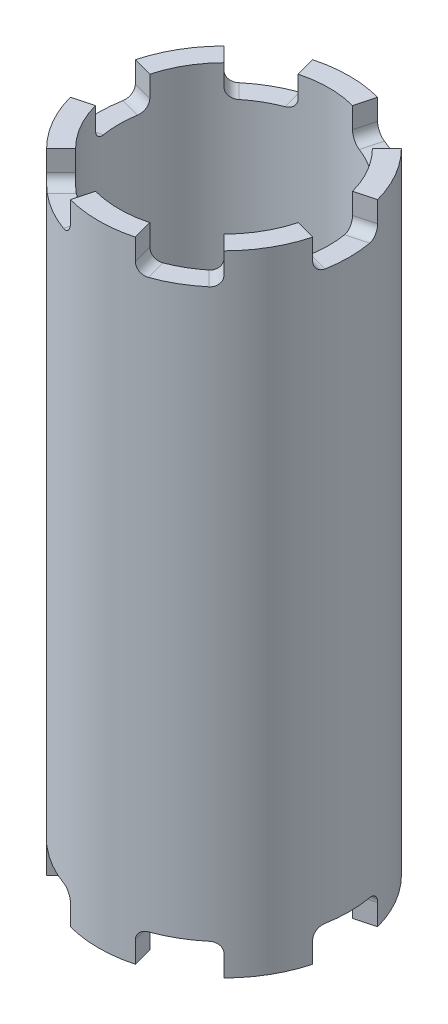
from build123d import *

# Parameters (mm, degrees)
SKETCH1_R            = 30.353
SKETCH1_R_2          = 25.4
BOSS_EXTRUDE1_DEPTH  = 152.4
CUT_EXTRUDE2_START   = -7.62
CUT_EXTRUDE2_DEPTH   = 7.62
FILLET1_R            = 2.54
FILLET1_OF_MIRROR1_R = 2.54


with BuildPart() as part:
    # Sketch1 → Boss-Extrude1 (new body)
    with BuildSketch(Plane(origin=(0, 0, 0), x_dir=(1, 0, 0), z_dir=(0, 1, 0))):
        Circle(SKETCH1_R)
        Circle(SKETCH1_R_2, mode=Mode.SUBTRACT)
    extrude(amount=BOSS_EXTRUDE1_DEPTH)

    # Sketch2 → Cut-Extrude2 (cut)
    with BuildSketch(Plane(origin=(0, 152.4, 0), x_dir=(1, 0, 0), z_dir=(0, 1, 0)).offset(CUT_EXTRUDE2_START)):
        with BuildLine():
            Line((24.534515988, 6.574003746), (29.318746605, 7.855934476))
            ThreePointArc((29.318746605, 7.855934476), (30.353, 0), (29.318746605, -7.855934476))
            Line((29.318746605, -7.855934476), (24.534515988, -6.574003746))
            ThreePointArc((24.534515988, -6.574003746), (25.4, 0), (24.534515988, 6.574003746))
        make_face()
        with BuildLine():
            Line((6.574003746, -24.534515988), (7.855934476, -29.318746605))
            ThreePointArc((7.855934476, -29.318746605), (15.1765, -26.286469081), (21.462812129, -21.462812129))
            Line((21.462812129, -21.462812129), (17.960512242, -17.960512242))
            ThreePointArc((17.960512242, -17.960512242), (12.7, -21.997045256), (6.574003746, -24.534515988))
        make_face()
        with BuildLine():
            Line((-17.960512242, -17.960512242), (-21.462812129, -21.462812129))
            ThreePointArc((-21.462812129, -21.462812129), (-15.1765, -26.286469081), (-7.855934476, -29.318746605))
            Line((-7.855934476, -29.318746605), (-6.574003746, -24.534515988))
            ThreePointArc((-6.574003746, -24.534515988), (-12.7, -21.997045256), (-17.960512242, -17.960512242))
        make_face()
        with BuildLine():
            Line((-24.534515988, 6.574003746), (-29.318746605, 7.855934476))
            ThreePointArc((-29.318746605, 7.855934476), (-30.353, 0), (-29.318746605, -7.855934476))
            Line((-29.318746605, -7.855934476), (-24.534515988, -6.574003746))
            ThreePointArc((-24.534515988, -6.574003746), (-25.4, 0), (-24.534515988, 6.574003746))
        make_face()
        with BuildLine():
            Line((-6.574003746, 24.534515988), (-7.855934476, 29.318746605))
            ThreePointArc((-7.855934476, 29.318746605), (-15.1765, 26.286469081), (-21.462812129, 21.462812129))
            Line((-21.462812129, 21.462812129), (-17.960512242, 17.960512242))
            ThreePointArc((-17.960512242, 17.960512242), (-12.7, 21.997045256), (-6.574003746, 24.534515988))
        make_face()
        with BuildLine():
            Line((17.960512242, 17.960512242), (21.462812129, 21.462812129))
            ThreePointArc((21.462812129, 21.462812129), (15.1765, 26.286469081), (7.855934476, 29.318746605))
            Line((7.855934476, 29.318746605), (6.574003746, 24.534515988))
            ThreePointArc((6.574003746, 24.534515988), (12.7, 21.997045256), (17.960512242, 17.960512242))
        make_face()
    cut_extrude2 = extrude(amount=CUT_EXTRUDE2_DEPTH, mode=Mode.SUBTRACT)

    # Fillet1
    fillet1_edges = [part.edges().sort_by_distance(p)[0] for p in [
        (26.926631297, 144.78, 7.214969111),
        (19.711662186, 144.78, 19.711662186),
        (-7.214969111, 144.78, 26.926631297),
        (7.214969111, 144.78, 26.926631297),
        (26.926631297, 144.78, -7.214969111),
        (19.711662186, 144.78, -19.711662186),
        (7.214969111, 144.78, -26.926631297),
        (-26.926631297, 144.78, 7.214969111),
        (-26.926631297, 144.78, -7.214969111),
        (-19.711662186, 144.78, -19.711662186),
        (-7.214969111, 144.78, -26.926631297),
        (-19.711662186, 144.78, 19.711662186),
    ]]
    fillet(fillet1_edges, radius=FILLET1_R)

    # Mirror1: Cut-Extrude2 across plane
    add(cut_extrude2.mirror(Plane(origin=(0, 76.2, 0), x_dir=(0, 0, 1), z_dir=(0, -1, 0))), mode=Mode.SUBTRACT)

    # Fillet1 of Mirror1
    fillet1_of_mirror1_edges = [part.edges().sort_by_distance(p)[0] for p in [
        (26.926631297, 7.62, 7.214969111),
        (19.711662186, 7.62, 19.711662186),
        (-7.214969111, 7.62, 26.926631297),
        (7.214969111, 7.62, 26.926631297),
        (26.926631297, 7.62, -7.214969111),
        (19.711662186, 7.62, -19.711662186),
        (7.214969111, 7.62, -26.926631297),
        (-26.926631297, 7.62, 7.214969111),
        (-26.926631297, 7.62, -7.214969111),
        (-19.711662186, 7.62, -19.711662186),
        (-7.214969111, 7.62, -26.926631297),
        (-19.711662186, 7.62, 19.711662186),
    ]]
    fillet(fillet1_of_mirror1_edges, radius=FILLET1_OF_MIRROR1_R)


solid = part.part
